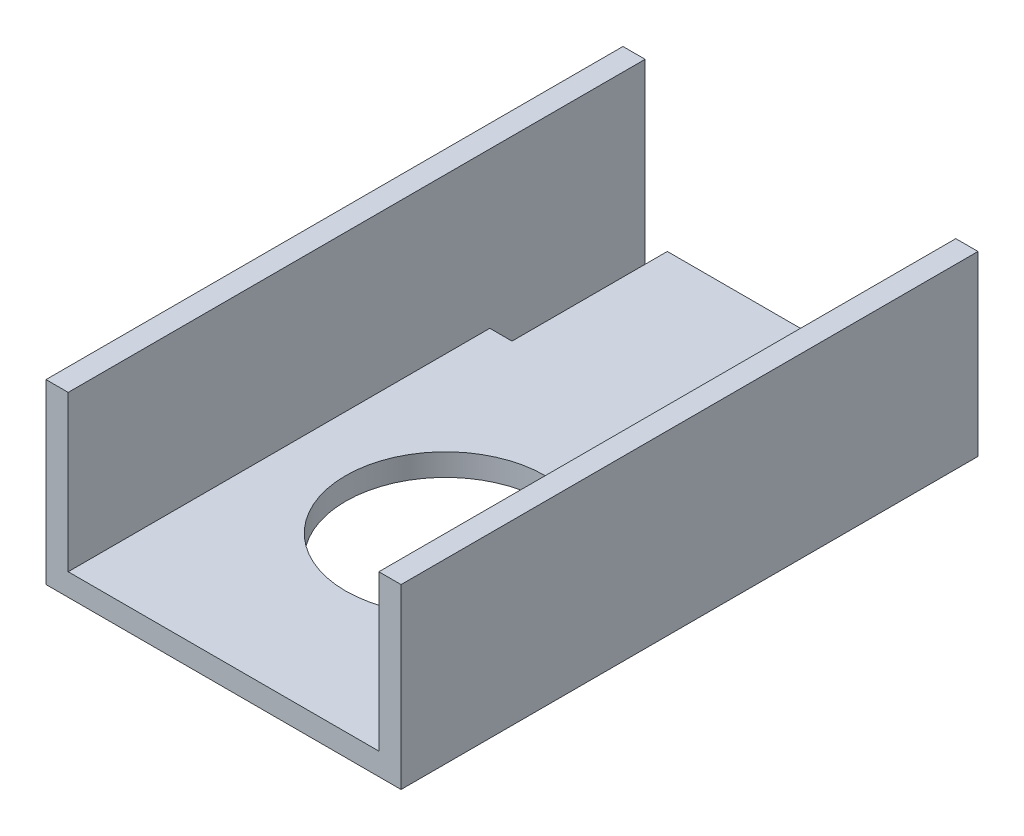
from build123d import *

# Parameters (mm, degrees)
BOSS_EXTRUDE1_DEPTH = 82.55
CUT_EXTRUDE1_REACH  = 102.201
SKETCH2_R           = 14.2875
CUT_EXTRUDE2_REACH  = 101.444
SKETCH3_W           = 3.175
SKETCH3_H           = 22.225


with BuildPart() as part:
    # Sketch1 → Boss-Extrude1 (new body)
    with BuildSketch(Plane.XY):
        Polygon((47.625, 3.175), (47.625, 25.4), (50.8, 25.4), (50.8, 0), (0, 0), (0, 25.4), (3.175, 25.4), (3.175, 3.175), align=None)
    extrude(amount=BOSS_EXTRUDE1_DEPTH)

    # Sketch2 → Cut-Extrude1 (cut, up to next)
    with BuildSketch(Plane.XZ, mode=Mode.PRIVATE) as cut_extrude1_sk1:
        with Locations((25.4, 50.8)):
            Circle(SKETCH2_R)
    cut_extrude1_tool1 = extrude(cut_extrude1_sk1.sketch, amount=-CUT_EXTRUDE1_REACH, mode=Mode.PRIVATE) & part.part
    add(cut_extrude1_tool1.solids().sort_by_distance((25.4, 0, 50.8))[0], mode=Mode.SUBTRACT)

    # Sketch3 → Cut-Extrude2 (cut, up to next)
    with BuildSketch(Plane(origin=(0, 3.175, 0), x_dir=(1, 0, 0), z_dir=(0, 1, 0)), mode=Mode.PRIVATE) as cut_extrude2_sk1:
        with Locations((4.7625, -11.1125)):
            Rectangle(SKETCH3_W, SKETCH3_H)
    cut_extrude2_tool1 = extrude(cut_extrude2_sk1.sketch, amount=-CUT_EXTRUDE2_REACH, mode=Mode.PRIVATE) & part.part
    add(cut_extrude2_tool1.solids().sort_by_distance((4.7625, 3.175, 11.1125))[0], mode=Mode.SUBTRACT)


solid = part.part
